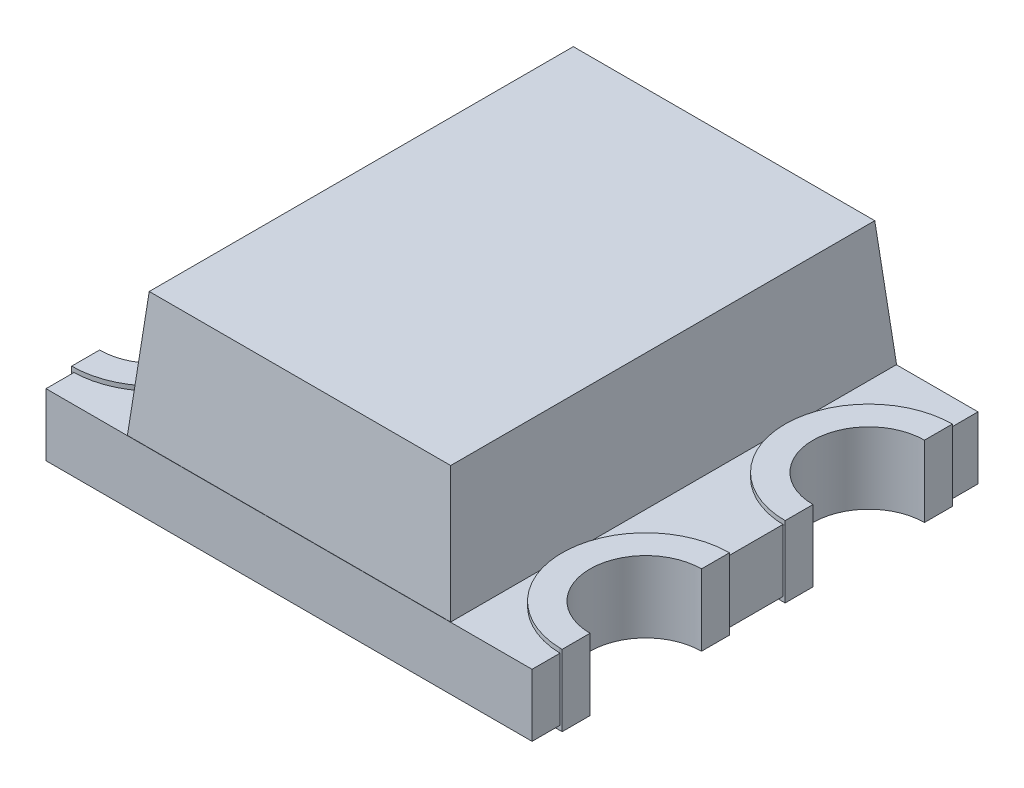
from build123d import *

# Parameters (mm, degrees)
SKETCH1_W             = 2.2
SKETCH1_H             = 2
BOSS_EXTRUDE1_DEPTH   = 0.28
BOSS_EXTRUDE2_DEPTH   = 0.02
CUT_EXTRUDE1_START    = -2
CUT_EXTRUDE1_DEPTH    = 2
SKETCH4_W             = 0.125
SKETCH4_H             = 0.28
SKETCH4_W_2           = 0.25
CUT_EXTRUDE2_DEPTH    = 0.01
SKETCH5_W             = 0.125
SKETCH5_H             = 0.28
SKETCH5_W_2           = 0.25
CUT_EXTRUDE3_DEPTH    = 0.01
SKETCH6_W             = 1.45
SKETCH6_H             = 2
BOSS_EXTRUDE3_DEPTH   = 0.56
BOSS_EXTRUDE3_TAPER   = 5
SKETCH8_W             = 1.45
SKETCH8_H             = 2
CUT_EXTRUDE4_DEPTH    = 0.001
BOSS_EXTRUDE4_DEPTH   = 0.02
BOSS_EXTRUDE6_DEPTH   = 0.02
BODY_MOVE_COPY1_ANGLE = 90
BODY_MOVE_COPY3_ANGLE = 90


with BuildPart() as part:
    # Sketch1 → Boss-Extrude1 (new body)
    with BuildSketch(Plane(origin=(0, 0, 0), x_dir=(1, 0, 0), z_dir=(0, 1, 0))):
        Rectangle(SKETCH1_W, SKETCH1_H)
    extrude(amount=BOSS_EXTRUDE1_DEPTH)

    # Sketch2 → Boss-Extrude2 (add)
    with BuildSketch(Plane(origin=(0, 0.28, 0), x_dir=(1, 0, 0), z_dir=(0, 1, 0))):
        with BuildLine():
            Line((-0.565, -0.125), (-1.1, -0.125))
            Line((-1.1, -0.125), (-1.1, -0.25))
            ThreePointArc((-1.1, -0.25), (-0.85, -0.5), (-1.1, -0.75))
            Line((-1.1, -0.75), (-1.1, -0.875))
            Line((-1.1, -0.875), (-0.565, -0.875))
            Line((-0.565, -0.875), (-0.565, -0.125))
        make_face()
        with BuildLine():
            Line((-0.565, 0.875), (-1.1, 0.875))
            Line((-1.1, 0.875), (-1.1, 0.75))
            ThreePointArc((-1.1, 0.75), (-0.85, 0.5), (-1.1, 0.25))
            Line((-1.1, 0.25), (-1.1, 0.125))
            Line((-1.1, 0.125), (-0.565, 0.125))
            Line((-0.565, 0.125), (-0.565, 0.875))
        make_face()
        with BuildLine():
            Line((1.1, 0.875), (0.565, 0.875))
            Line((0.565, 0.875), (0.565, 0.125))
            Line((0.565, 0.125), (1.1, 0.125))
            Line((1.1, 0.125), (1.1, 0.25))
            ThreePointArc((1.1, 0.25), (0.85, 0.5), (1.1, 0.75))
            Line((1.1, 0.75), (1.1, 0.875))
        make_face()
        with BuildLine():
            Line((1.1, -0.25), (1.1, -0.125))
            Line((1.1, -0.125), (0.565, -0.125))
            Line((0.565, -0.125), (0.565, -0.875))
            Line((0.565, -0.875), (1.1, -0.875))
            Line((1.1, -0.875), (1.1, -0.75))
            ThreePointArc((1.1, -0.75), (0.85, -0.5), (1.1, -0.25))
        make_face()
    extrude(amount=BOSS_EXTRUDE2_DEPTH)

    # Sketch3 → Cut-Extrude1 (cut)
    with BuildSketch(Plane(origin=(0, 0.28, 0), x_dir=(1, 0, 0), z_dir=(0, 1, 0)).offset(CUT_EXTRUDE1_START)):
        with BuildLine():
            Line((-1.1, 0.75), (-1.1, 0.25))
            ThreePointArc((-1.1, 0.25), (-0.85, 0.5), (-1.1, 0.75))
        make_face()
        with BuildLine():
            Line((-1.1, -0.25), (-1.1, -0.75))
            ThreePointArc((-1.1, -0.75), (-0.85, -0.5), (-1.1, -0.25))
        make_face()
        with BuildLine():
            Line((1.1, 0.25), (1.1, 0.75))
            ThreePointArc((1.1, 0.75), (0.85, 0.5), (1.1, 0.25))
        make_face()
        with BuildLine():
            Line((1.1, -0.75), (1.1, -0.25))
            ThreePointArc((1.1, -0.25), (0.85, -0.5), (1.1, -0.75))
        make_face()
    extrude(amount=CUT_EXTRUDE1_DEPTH, mode=Mode.SUBTRACT)

    # Sketch4 → Cut-Extrude2 (cut)
    with BuildSketch(Plane.ZY.offset(1.1)):
        with Locations((-0.9375, 0.14)):
            Rectangle(SKETCH4_W, SKETCH4_H)
        with Locations((0, 0.14)):
            Rectangle(SKETCH4_W_2, SKETCH4_H)
        with Locations((0.9375, 0.14)):
            Rectangle(SKETCH4_W, SKETCH4_H)
    extrude(amount=-CUT_EXTRUDE2_DEPTH, mode=Mode.SUBTRACT)

    # Sketch5 → Cut-Extrude3 (cut)
    with BuildSketch(Plane(origin=(1.1, 0, 0), x_dir=(0, 0, -1), z_dir=(1, 0, 0))):
        with Locations((-0.9375, 0.14)):
            Rectangle(SKETCH5_W, SKETCH5_H)
        with Locations((0, 0.14)):
            Rectangle(SKETCH5_W_2, SKETCH5_H)
        with Locations((0.9375, 0.14)):
            Rectangle(SKETCH5_W, SKETCH5_H)
    extrude(amount=-CUT_EXTRUDE3_DEPTH, mode=Mode.SUBTRACT)

    # Sketch6 → Boss-Extrude3 (add)
    with BuildSketch(Plane.XZ):
        Rectangle(SKETCH6_W, SKETCH6_H)
    extrude(amount=BOSS_EXTRUDE3_DEPTH, taper=BOSS_EXTRUDE3_TAPER)

    # Sketch8 → Cut-Extrude4 (cut)
    with BuildSketch(Plane.XZ):
        Rectangle(SKETCH8_W, SKETCH8_H)
    extrude(amount=CUT_EXTRUDE4_DEPTH, mode=Mode.SUBTRACT)


with BuildPart() as cut_extrude4_piece_1:
    # of the separate pieces the step leaves, piece 1, a body of its own (cut_extrude4_pieces)
    add(part.part.solids().sort_by_distance((-0.724912511, -0.001, -0.999912511))[0])



with BuildPart() as cut_extrude4_piece_2:
    # of the separate pieces the step leaves, piece 2, a body of its own (cut_extrude4_pieces)
    add(part.part.solids().sort_by_distance((1.09, 0, -1))[0])


with BuildPart() as cut_extrude4_piece_1_1:
    add(cut_extrude4_piece_1.part)

    add(cut_extrude4_piece_2.part)  # Boss-Extrude4 merges Cut-Extrude4 piece 2
    # Sketch9 → Boss-Extrude4 (add)
    with BuildSketch(Plane.XZ):
        with BuildLine():
            Line((-1.1, -0.75), (-1.1, -0.875))
            ThreePointArc((-1.1, -0.875), (-0.725, -0.5), (-1.1, -0.125))
            Line((-1.1, -0.125), (-1.1, -0.25))
            ThreePointArc((-1.1, -0.25), (-0.85, -0.5), (-1.1, -0.75))
        make_face()
        with BuildLine():
            ThreePointArc((1.09, -0.125), (0.72486669, -0.5), (1.09, -0.875))
            Line((1.09, -0.875), (1.1, -0.875))
            Line((1.1, -0.875), (1.1, -0.75))
            ThreePointArc((1.1, -0.75), (0.85, -0.5), (1.1, -0.25))
            Line((1.1, -0.25), (1.1, -0.125))
            Line((1.1, -0.125), (1.09, -0.125))
        make_face()
        with BuildLine():
            Line((-1.1, 0.25), (-1.1, 0.125))
            ThreePointArc((-1.1, 0.125), (-0.725, 0.5), (-1.1, 0.875))
            Line((-1.1, 0.875), (-1.1, 0.75))
            ThreePointArc((-1.1, 0.75), (-0.85, 0.5), (-1.1, 0.25))
        make_face()
        with BuildLine():
            ThreePointArc((1.1, 0.875), (0.725, 0.5), (1.1, 0.125))
            Line((1.1, 0.125), (1.1, 0.25))
            ThreePointArc((1.1, 0.25), (0.85, 0.5), (1.1, 0.75))
            Line((1.1, 0.75), (1.1, 0.875))
        make_face()
    extrude(amount=BOSS_EXTRUDE4_DEPTH)

    # Sketch12 → Boss-Extrude6 (add)
    with BuildSketch(Plane(origin=(0, 0.28, 0), x_dir=(1, 0, 0), z_dir=(0, 1, 0))):
        with BuildLine():
            Line((0.515, 0.675), (0.515, -0.675))
            ThreePointArc((0.515, -0.675), (0.315, -0.875), (0.115, -0.675))
            Line((0.115, -0.675), (0.115, 0.675))
            ThreePointArc((0.115, 0.675), (0.315, 0.875), (0.515, 0.675))
        make_face()
    extrude(amount=BOSS_EXTRUDE6_DEPTH)


with BuildPart() as cut_extrude4_piece_1_2:
    # Body-Move/Copy1: moved
    add(cut_extrude4_piece_1_1.part.rotate(Axis((0, 0, 0), (-1, 0, 0)), BODY_MOVE_COPY1_ANGLE))


with BuildPart() as cut_extrude4_piece_1_3:
    # Body-Move/Copy2: moved
    add(cut_extrude4_piece_1_2.part.moved(Location((0, 0, 0.3))))


with BuildPart() as cut_extrude4_piece_1_4:
    # Body-Move/Copy3: moved
    add(cut_extrude4_piece_1_3.part.rotate(Axis((0, 0, 0), (-1, 0, 0)), BODY_MOVE_COPY3_ANGLE))


solid = cut_extrude4_piece_1_4.part
